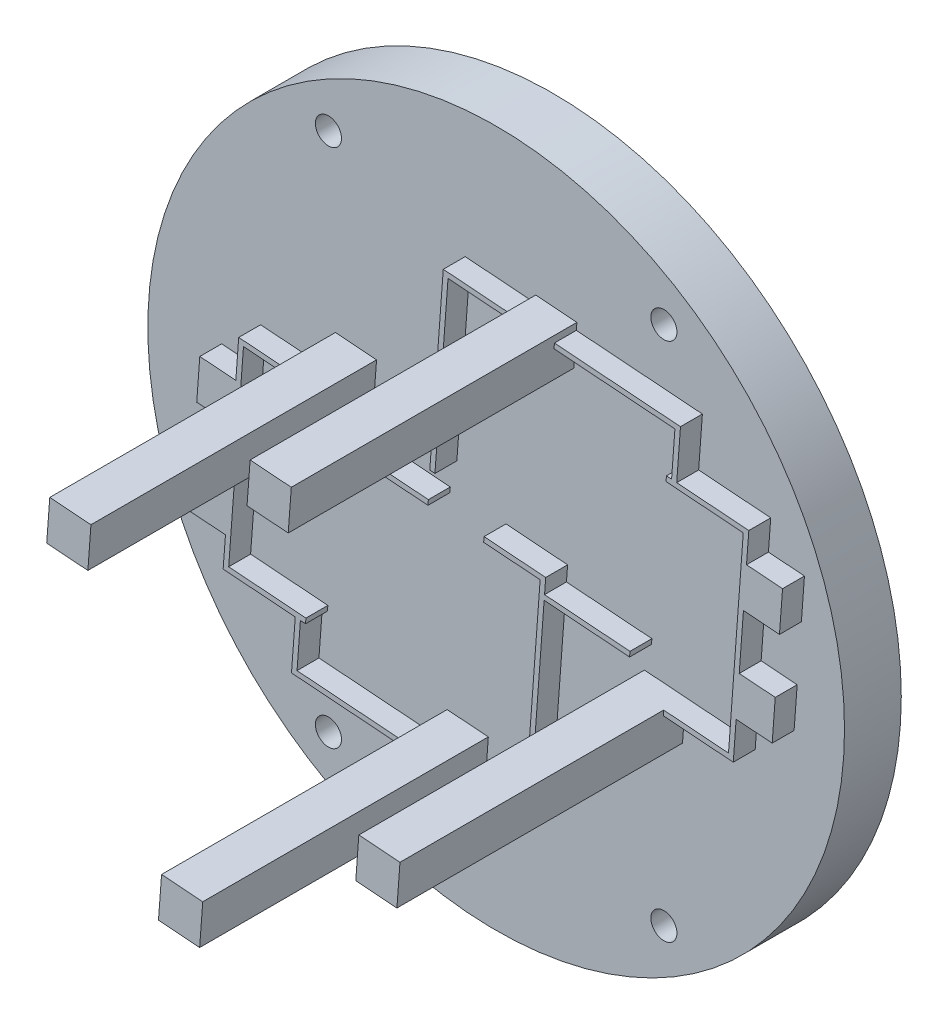
from build123d import *

# Parameters (mm, degrees)
SKETCH2_R            = 67.5
BOSS_EXTRUDE2_DEPTH  = 11
SKETCH3_R            = 66
CUT_EXTRUDE11_DEPTH  = 3
BOSS_EXTRUDE3_DEPTH  = 63.34
BOSS_EXTRUDE10_DEPTH = 12.25
BOSS_EXTRUDE11_DEPTH = 12.25
BOSS_EXTRUDE12_START = -12.25
BOSS_EXTRUDE12_DEPTH = 4.25
BOSS_EXTRUDE13_DEPTH = 12.25
SKETCH4_10_R         = 2.5273
CUT_EXTRUDE12_DEPTH  = 12.25


# Read off the part's stored shape, not the designer's step: Boss-Extrude12
with BuildPart() as part:
    # Sketch2 → Boss-Extrude2 (new body)
    with BuildSketch(Plane.XY):
        Circle(SKETCH2_R)
    extrude(amount=BOSS_EXTRUDE2_DEPTH)

    # Sketch3 → Cut-Extrude11 (cut)
    with BuildSketch(Plane(origin=(0, 0, 0), x_dir=(-1, 0, 0), z_dir=(0, 0, -1))):
        Circle(SKETCH3_R)
    extrude(amount=-CUT_EXTRUDE11_DEPTH, mode=Mode.SUBTRACT)

    # Sketch4 → Boss-Extrude3 (add)
    with BuildSketch(Plane(origin=(0, 0, 3), x_dir=(-1, 0, 0), z_dir=(0, 0, -1))):
        Polygon((-36.106368438, -18.003584956), (-28.133944044, -17.408739697), (-28.729209741, -9.430900362), (-36.701616568, -10.025761076), (-36.627210549, -11.022989106), align=None)
        Polygon((2.114943846, -43.743465349), (10.09276687, -43.148200869), (9.49750239, -35.170377845), (1.519679366, -35.765642325), align=None)
        Polygon((31.67620014, 10.293427606), (31.75060616, 9.296199576), (23.772783163, 8.700934735), (23.177535005, 16.678758977), (31.155358029, 17.274023457), align=None)
        Polygon((-7.664290982, 42.969259013), (-15.642114006, 42.373994533), (-15.046849526, 34.396171509), (-7.069026502, 34.991435989), align=None)
    extrude(amount=-BOSS_EXTRUDE3_DEPTH)



with BuildPart() as body_2:
    # Sketch4<6> → Boss-Extrude10 (new body)
    with BuildSketch(Plane(origin=(0, 0, 3), x_dir=(-1, 0, 0), z_dir=(0, 0, -1))):
        Polygon((-37.237933985, 29.544025614), (-53.20294076, 28.352798205), (-50.189331626, -12.034925436), (-36.627210549, -11.022989106), (-36.701616568, -10.025761076), (-49.266513848, -10.96328965), (-52.131302781, 27.429978539), (-37.163525925, 28.546797736), align=None)
    extrude(amount=-BOSS_EXTRUDE10_DEPTH)


with BuildPart() as part_1:
    add(part.part)

    add(body_2.part)  # Boss-Extrude11 merges body 2
    # Sketch4<7> → Boss-Extrude11 (add)
    with BuildSketch(Plane(origin=(0, 0, 3), x_dir=(-1, 0, 0), z_dir=(0, 0, -1))):
        Polygon((-15.463534662, 39.980647626), (-15.537942722, 40.977875504), (-39.960658599, 39.155576962), (-39.232389741, 29.395209494), (-38.235161863, 29.469617554), (-38.889022661, 38.232757144), align=None)
        Polygon((6.002179443, 42.585089599), (-7.560119698, 41.573139984), (-7.485711638, 40.575912106), (5.079359625, 41.513453661), (7.61667447, 7.507983023), (8.613902348, 7.582391083), align=None)
    extrude(amount=-BOSS_EXTRUDE11_DEPTH)

    # Boss-Extrude12 outline → Boss-Extrude12 (add)
    with BuildSketch(Plane(origin=(0, 0, 3), x_dir=(-1, 0, 0), z_dir=(0, 0, -1)).offset(BOSS_EXTRUDE12_START)):
        Polygon((31.67620014, 10.293427606), (31.75060616, 9.296199576), (44.714394547, 10.263491961), (47.579183525, -28.129776815), (32.611406667, -29.246596012), (32.685814727, -30.24382389), (33.683042605, -30.16941583), (34.336903403, -38.93255542), (9.914187526, -40.754853962), (9.988595586, -41.75208184), (35.408539341, -39.855375238), (34.680270483, -30.09500777), (48.650821503, -29.05259648), (45.637212368, 11.33512716), align=None)
        Polygon((-13.619910772, -2.199099303), (-30.173893546, -3.434273099), (-30.099485486, -4.431500977), (-13.545502712, -3.196327181), (-10.5542987, -43.284887875), (2.010772562, -42.347346319), (1.936364502, -41.350118441), (-9.631478882, -42.213251937), (-12.771499014, -0.130235487), (-1.826827461, 0.686400104), (-1.901235521, 1.683627982), (-13.843134952, 0.792584331), align=None)
        Polygon((25.621774288, 2.734474823), (25.547366228, 3.731702701), (8.892344879, 2.488989922), (8.966752939, 1.491762044), align=None)
    extrude(amount=BOSS_EXTRUDE12_DEPTH)

    # Sketch4<9> → Boss-Extrude13 (add)
    with BuildSketch(Plane(origin=(0, 0, 3), x_dir=(-1, 0, 0), z_dir=(0, 0, -1))):
        Polygon((-50.748151509, -4.545744855), (-51.343432315, 3.432076951), (-58.324046353, 2.911219122), (-57.728798463, -5.06660514), align=None)
        Polygon((-52.161943422, 14.401581934), (-52.757224228, 22.379403739), (-59.737760091, 21.858551743), (-59.142512201, 13.880727481), align=None)
        Polygon((46.196032252, 3.845946579), (46.791313057, -4.131875227), (53.771927095, -3.611017397), (53.176679206, 4.366806864), align=None)
        Polygon((47.609824165, -15.10138021), (48.205104971, -23.079202015), (55.185640833, -22.558350019), (54.590392944, -14.580525757), align=None)
    extrude(amount=-BOSS_EXTRUDE13_DEPTH)

    # Sketch4<10> → Cut-Extrude12 (cut)
    with BuildSketch(Plane(origin=(0, 0, 3), x_dir=(-1, 0, 0), z_dir=(0, 0, -1))):
        with Locations((-32.5, 50.435602505)):
            Circle(SKETCH4_10_R)
        with Locations((-32.5, -50.435602505)):
            Circle(SKETCH4_10_R)
        with Locations((32.5, -50.435602505)):
            Circle(SKETCH4_10_R)
        with Locations((32.5, 50.435602505)):
            Circle(SKETCH4_10_R)
    extrude(amount=-CUT_EXTRUDE12_DEPTH, mode=Mode.SUBTRACT)


solid = part_1.part
